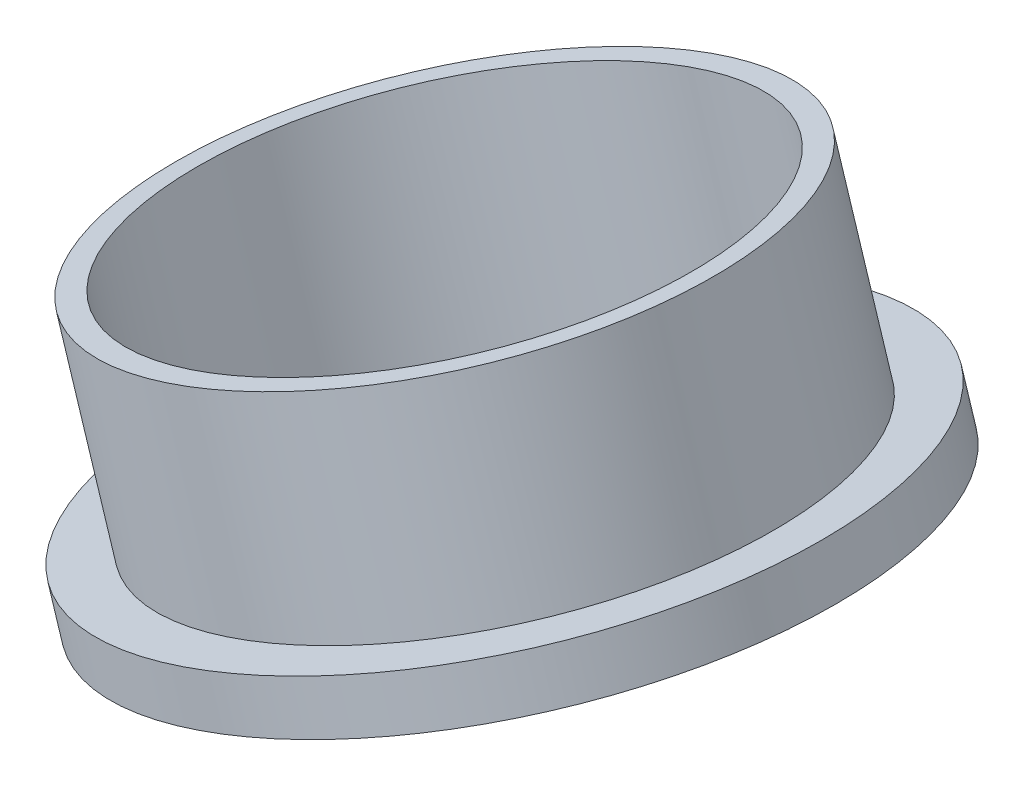
from build123d import *


with BuildPart() as part:
    # Sk_Cazoleta → Cazoleta (revolve)
    with BuildSketch(Plane.XY):
        Polygon((420.669370884, 409.515715484), (422.00457087, 409.936715479), (425.613142262, 398.492144167), (428.47428509, 399.394287015), (429.376427938, 396.533144187), (425.180085124, 395.210001344), align=None)
    revolve(axis=Axis((404.287856765, 409.593144054, 0), (0.3007142826457708, -0.9537142759825081, 0)))


solid = part.part
